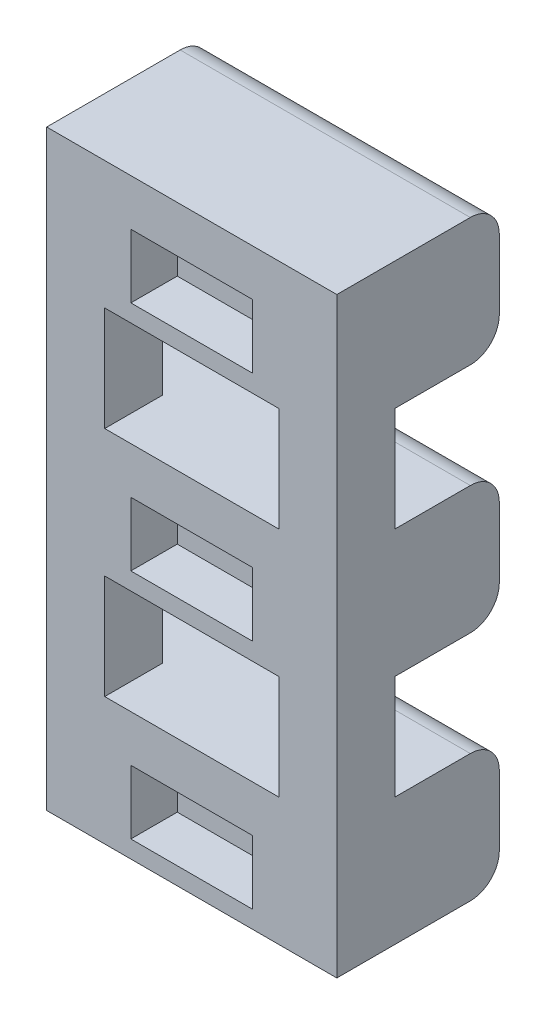
from build123d import *

# Parameters (mm, degrees)
SKETCH_1_W              = 5
SKETCH_1_H              = 2.2
EXTRUDE_1_DEPTH         = 2.8
SKETCH_2_W              = 2.1
SKETCH_2_H              = 1.1
CUT_EXTRUDE_1_DEPTH     = 0.8
FILLET_1_R              = 0.5
MOVE_START              = -2.5
MOVE_BODY_1_DEPTH       = 5
MOVE_BODY_1_2_OUTLINE_W = 1.1
MOVE_BODY_1_2_OUTLINE_H = 0.8
MOVE_BODY_1_2_DEPTH     = 1.45
MOVE_START_2            = 1.05
MOVE_BODY_1_3_OUTLINE_W = 1.1
MOVE_BODY_1_3_OUTLINE_H = 0.8
MOVE_BODY_1_3_DEPTH     = 1.45
MOVE_BODY_1_4_DEPTH     = 5
MOVE_BODY_1_5_OUTLINE_W = 1.1
MOVE_BODY_1_5_OUTLINE_H = 0.8
MOVE_BODY_1_5_DEPTH     = 1.45
MOVE_BODY_1_6_OUTLINE_W = 1.1
MOVE_BODY_1_6_OUTLINE_H = 0.8
MOVE_BODY_1_6_DEPTH     = 1.45
SKETCH_3_W              = 1
SKETCH_3_H              = 1
EXTRUDE_2_DEPTH         = 1.8
SKETCH_4_W              = 1
SKETCH_4_H              = 1
EXTRUDE_3_DEPTH         = 1.8


# Read off the part's stored shape, not the designer's step: 实体-移动/复制1
with BuildPart() as part:
    # 草图1 → 凸台-拉伸1 (new body)
    with BuildSketch(Plane.XY):
        Rectangle(SKETCH_1_W, SKETCH_1_H)
    extrude(amount=EXTRUDE_1_DEPTH)

    # 草图2 → 切除-拉伸1 (cut)
    with BuildSketch(Plane.XY.offset(2.8)):
        with Locations((0, -0.25)):
            Rectangle(SKETCH_2_W, SKETCH_2_H)
    extrude(amount=-CUT_EXTRUDE_1_DEPTH, mode=Mode.SUBTRACT)

    # 圆角1
    fillet_1_edges = [part.edges().sort_by_distance(p)[0] for p in [
        (0, -1.1, 0),
        (0, 1.1, 0),
    ]]
    fillet(fillet_1_edges, radius=FILLET_1_R)



with BuildPart() as body_2:
    # Move Body 1 outline → Move Body 1 (new body)
    with BuildSketch(Plane.YZ.offset(MOVE_START)):
        with BuildLine():
            Line((9.1, 0.5), (9.1, 2.8))
            Line((9.1, 2.8), (8.3, 2.8))
            Line((8.3, 2.8), (8.3, 2))
            Line((8.3, 2), (7.2, 2))
            Line((7.2, 2), (7.2, 2.8))
            Line((7.2, 2.8), (6.9, 2.8))
            Line((6.9, 2.8), (6.9, 0.5))
            ThreePointArc((6.9, 0.5), (7.046446609, 0.146446609), (7.4, 0))
            Line((7.4, 0), (8.6, 0))
            ThreePointArc((8.6, 0), (8.953553391, 0.146446609), (9.1, 0.5))
        make_face()
    extrude(amount=MOVE_BODY_1_DEPTH)

    # Move Body 1 2 outline → Move Body 1 2 (add)
    with BuildSketch(Plane.YZ.offset(MOVE_START)):
        with Locations((7.75, 2.4)):
            Rectangle(MOVE_BODY_1_2_OUTLINE_W, MOVE_BODY_1_2_OUTLINE_H)
    extrude(amount=MOVE_BODY_1_2_DEPTH)

    # Move Body 1 3 outline → Move Body 1 3 (add)
    with BuildSketch(Plane.YZ.offset(MOVE_START_2)):
        with Locations((7.75, 2.4)):
            Rectangle(MOVE_BODY_1_3_OUTLINE_W, MOVE_BODY_1_3_OUTLINE_H)
    extrude(amount=MOVE_BODY_1_3_DEPTH)


with BuildPart() as body_3:
    # Move Body 1 4 outline → Move Body 1 4 (new body)
    with BuildSketch(Plane.YZ.offset(MOVE_START)):
        with BuildLine():
            Line((5.1, 0.5), (5.1, 2.8))
            Line((5.1, 2.8), (4.3, 2.8))
            Line((4.3, 2.8), (4.3, 2))
            Line((4.3, 2), (3.2, 2))
            Line((3.2, 2), (3.2, 2.8))
            Line((3.2, 2.8), (2.9, 2.8))
            Line((2.9, 2.8), (2.9, 0.5))
            ThreePointArc((2.9, 0.5), (3.046446609, 0.146446609), (3.4, 0))
            Line((3.4, 0), (4.6, 0))
            ThreePointArc((4.6, 0), (4.953553391, 0.146446609), (5.1, 0.5))
        make_face()
    extrude(amount=MOVE_BODY_1_4_DEPTH)

    # Move Body 1 5 outline → Move Body 1 5 (add)
    with BuildSketch(Plane.YZ.offset(MOVE_START)):
        with Locations((3.75, 2.4)):
            Rectangle(MOVE_BODY_1_5_OUTLINE_W, MOVE_BODY_1_5_OUTLINE_H)
    extrude(amount=MOVE_BODY_1_5_DEPTH)

    # Move Body 1 6 outline → Move Body 1 6 (add)
    with BuildSketch(Plane.YZ.offset(MOVE_START_2)):
        with Locations((3.75, 2.4)):
            Rectangle(MOVE_BODY_1_6_OUTLINE_W, MOVE_BODY_1_6_OUTLINE_H)
    extrude(amount=MOVE_BODY_1_6_DEPTH)


with BuildPart() as part_1:
    add(part.part)

    add(body_3.part)  # 凸台-拉伸2 merges body 3
    # 草图3 → 凸台-拉伸2 (add)
    with BuildSketch(Plane(origin=(0, 1.1, 0), x_dir=(1, 0, 0), z_dir=(0, 1, 0))):
        with Locations((-2, -2.3)):
            Rectangle(SKETCH_3_W, SKETCH_3_H)
        with Locations((2, -2.3)):
            Rectangle(SKETCH_3_W, SKETCH_3_H)
    extrude(amount=EXTRUDE_2_DEPTH)


    add(body_2.part)  # 凸台-拉伸3 merges body 2
    # 草图4 → 凸台-拉伸3 (add)
    with BuildSketch(Plane(origin=(0, 5.1, 0), x_dir=(1, 0, 0), z_dir=(0, 1, 0))):
        with Locations((2, -2.3)):
            Rectangle(SKETCH_4_W, SKETCH_4_H)
        with Locations((-2, -2.3)):
            Rectangle(SKETCH_4_W, SKETCH_4_H)
    extrude(amount=EXTRUDE_3_DEPTH)


solid = part_1.part
